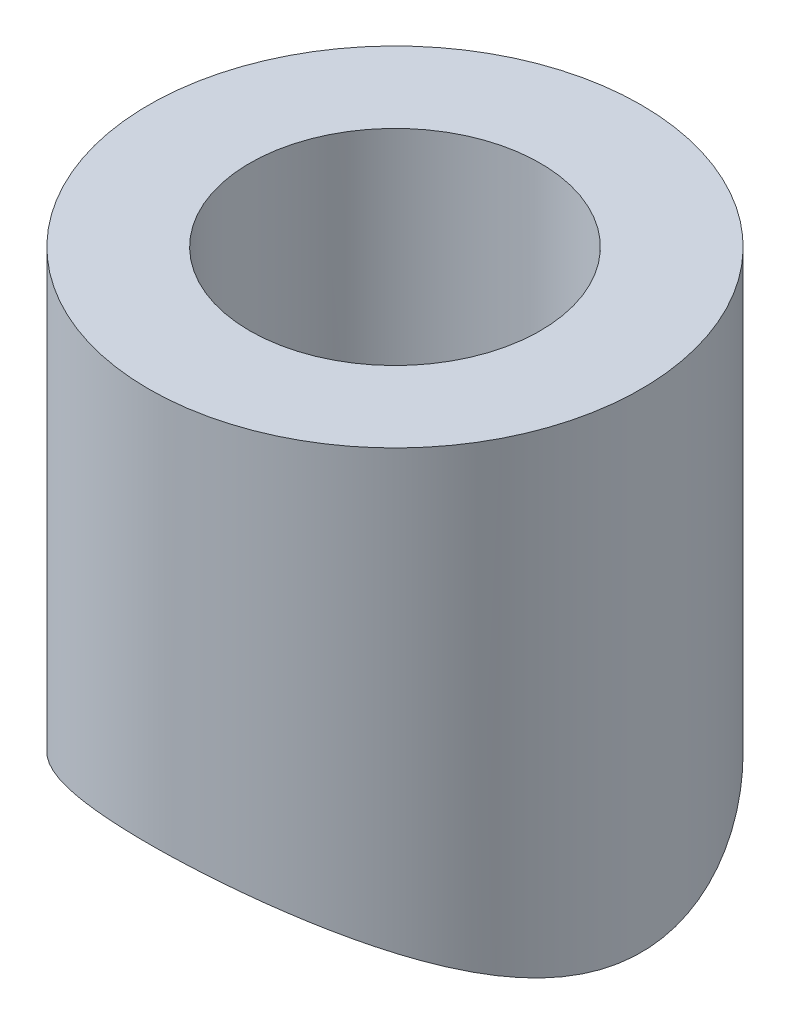
from build123d import *

# Parameters (mm, degrees)
SKETCH1_R               = 10
BOSS_EXTRUDE1_DEPTH     = 20
CUT_EXTRUDE1_DEPTH      = 25.494897428
CUT_EXTRUDE1_DEPTH_BACK = 25.494897428
SKETCH2_R               = 15
G1_4_TAPPED_HOLE1_D     = 11.8


with BuildPart() as part:
    # Sketch1 → Boss-Extrude1 (new body)
    with BuildSketch(Plane(origin=(0, 0, 0), x_dir=(1, 0, 0), z_dir=(0, 1, 0))):
        Circle(SKETCH1_R)
    extrude(amount=BOSS_EXTRUDE1_DEPTH)

    # Sketch2 → Cut-Extrude1 (cut, two sides: drawn at the far end of the back side and taken through both)
    with BuildSketch(Plane.XY.offset(-CUT_EXTRUDE1_DEPTH_BACK)):
        with Locations((0, -11)):
            Circle(SKETCH2_R)
    extrude(amount=CUT_EXTRUDE1_DEPTH + CUT_EXTRUDE1_DEPTH_BACK, mode=Mode.SUBTRACT)

    # G1/4 Tapped Hole1 (through all)
    with Locations(Plane(origin=(0, 20, 0), x_dir=(1, 0, 0), z_dir=(0, 1, 0))):
        with Locations((0, 0)):
            Hole(G1_4_TAPPED_HOLE1_D / 2)


solid = part.part
